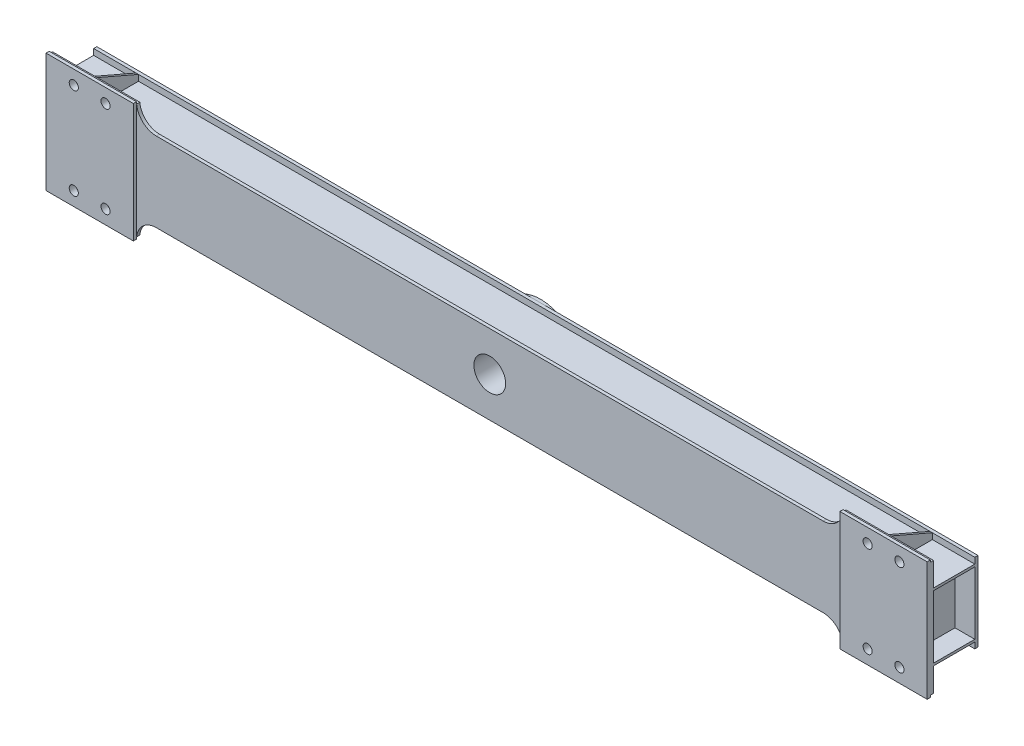
from build123d import *

# Parameters (mm, degrees)
SKETCH_1_W                       = 2220
SKETCH_1_H                       = 300
EXTRUDE_1_DEPTH                  = 120
SKETCH_2_W                       = 1780
SKETCH_2_H                       = 50
CUT_EXTRUDE_1_DEPTH              = 2244.390291501
SKETCH_3_W                       = 220
SKETCH_3_H                       = 300
EXTRUDE_2_DEPTH                  = 8
SKETCH_4_W                       = 2220
SKETCH_4_H                       = 120
CUT_EXTRUDE_2_DEPTH              = 5
SKETCH_5_W                       = 2220
SKETCH_5_H                       = 120
CUT_EXTRUDE_3_DEPTH              = 5
CUT_EXTRUDE_11_DEPTH             = 2244.832435812
SKETCH_14_W                      = 6
SKETCH_14_H                      = 104
EXTRUDE_3_DEPTH                  = 60
SKETCH_16_W                      = 6
SKETCH_16_H                      = 104
EXTRUDE_4_DEPTH                  = 60
CUT_EXTRUDE_12_DEPTH             = 2139.025490961
PATTERN_LINEAR_2_COUNT           = 2
PATTERN_LINEAR_2_PITCH           = 2000
FILLET_3_R                       = 50
SKETCH_17_W                      = 104
SKETCH_17_H                      = 158
CUT_EXTRUDE_13_DEPTH             = 50
SKETCH_18_W                      = 104
SKETCH_18_H                      = 158
CUT_EXTRUDE_14_DEPTH             = 50
SKETCH_19_R                      = 100
EXTRUDE_5_DEPTH                  = 8
SKETCH_20_R                      = 40
CUT_EXTRUDE_15_DEPTH             = 2245.303009845
SKETCH_21_R                      = 11.5
CUT_EXTRUDE_16_DEPTH             = 2245.303009845
PATTERN_LINEAR_3_COUNT           = 2
PATTERN_LINEAR_3_PITCH           = 80
PATTERN_LINEAR_3_COUNT_DIR2      = 2
PATTERN_LINEAR_3_PITCH_DIR2      = 230
PATTERN_LINEAR_4_COUNT           = 2
PATTERN_LINEAR_4_PITCH           = 2000
PATTERN_LINEAR_4_COPY_1_SKETCH_R = 11.5
PATTERN_LINEAR_4_COPY_1_DEPTH    = 2245.303009845
PATTERN_LINEAR_4_COPY_2_SKETCH_R = 11.5
PATTERN_LINEAR_4_COPY_2_DEPTH    = 2245.303009845
PATTERN_LINEAR_4_COPY_3_SKETCH_R = 11.5
PATTERN_LINEAR_4_COPY_3_DEPTH    = 2245.303009845
SKETCH_22_R                      = 5
CUT_EXTRUDE_17_DEPTH             = 100
PATTERN_LINEAR_5_COUNT           = 2
PATTERN_LINEAR_5_PITCH           = 80
PATTERN_LINEAR_5_COUNT_DIR2      = 2
PATTERN_LINEAR_5_PITCH_DIR2      = 80
PATTERN_LINEAR_6_COUNT           = 2
PATTERN_LINEAR_6_PITCH           = 2000
PATTERN_LINEAR_6_COPY_1_SKETCH_R = 5
PATTERN_LINEAR_6_COPY_1_DEPTH    = 100
PATTERN_LINEAR_6_COPY_2_SKETCH_R = 5
PATTERN_LINEAR_6_COPY_2_DEPTH    = 100
PATTERN_LINEAR_6_COPY_3_SKETCH_R = 5
PATTERN_LINEAR_6_COPY_3_DEPTH    = 100


with BuildPart() as part:
    # 草图1 → 凸台-拉伸1 (new body)
    with BuildSketch(Plane.XY):
        with Locations((1110, 150)):
            Rectangle(SKETCH_1_W, SKETCH_1_H)
    extrude(amount=EXTRUDE_1_DEPTH)

    # 草图2 → 切除-拉伸1 (cut, through all)
    with BuildSketch(Plane.XY.offset(120)):
        with Locations((1110, 275)):
            Rectangle(SKETCH_2_W, SKETCH_2_H)
        with Locations((1110, 25)):
            Rectangle(SKETCH_2_W, SKETCH_2_H)
    extrude(amount=-CUT_EXTRUDE_1_DEPTH, mode=Mode.SUBTRACT)

    # 草图3 → 凸台-拉伸2 (add)
    with BuildSketch(Plane.XY.offset(120)):
        with Locations((110, 150)):
            Rectangle(SKETCH_3_W, SKETCH_3_H)
        with Locations((2110, 150)):
            Rectangle(SKETCH_3_W, SKETCH_3_H)
    extrude(amount=EXTRUDE_2_DEPTH)

    # 草图4 → 切除-拉伸2 (cut)
    with BuildSketch(Plane(origin=(0, 300, 0), x_dir=(1, 0, 0), z_dir=(0, 1, 0))):
        with Locations((1110, -60)):
            Rectangle(SKETCH_4_W, SKETCH_4_H)
    extrude(amount=-CUT_EXTRUDE_2_DEPTH, mode=Mode.SUBTRACT)

    # 草图5 → 切除-拉伸3 (cut)
    with BuildSketch(Plane.XZ):
        with Locations((1110, 60)):
            Rectangle(SKETCH_5_W, SKETCH_5_H)
    extrude(amount=-CUT_EXTRUDE_3_DEPTH, mode=Mode.SUBTRACT)

    # 草图13 → 切除-拉伸11 (cut, through all)
    with BuildSketch(Plane(origin=(2220, 0, 0), x_dir=(0, 0, -1), z_dir=(1, 0, 0))):
        Polygon((-112, 235), (-8, 235), (-8, 250), (0, 250), (0, 295), (-112, 295), align=None)
        Polygon((-112, 5), (0, 5), (0, 50), (-8, 50), (-8, 65), (-112, 65), align=None)
    extrude(amount=-CUT_EXTRUDE_11_DEPTH, mode=Mode.SUBTRACT)

    # 草图14 → 凸台-拉伸3 (add)
    with BuildSketch(Plane(origin=(0, 235, 0), x_dir=(1, 0, 0), z_dir=(0, 1, 0))):
        with Locations((2110, -60)):
            Rectangle(SKETCH_14_W, SKETCH_14_H)
    extrude_3 = extrude(amount=EXTRUDE_3_DEPTH)

    # 草图16 → 凸台-拉伸4 (add)
    with BuildSketch(Plane.XZ.offset(-65)):
        with Locations((2110, 60)):
            Rectangle(SKETCH_16_W, SKETCH_16_H)
    extrude_4 = extrude(amount=EXTRUDE_4_DEPTH)

    # 草图15 → 切除-拉伸12 (cut, through all)
    with BuildSketch(Plane(origin=(2113, 0, 0), x_dir=(0, 0, -1), z_dir=(1, 0, 0))):
        Polygon((-8, 295), (-8, 250), (-112, 295), align=None)
        Polygon((-8, 50), (-112, 5), (-8, 5), align=None)
    cut_extrude_12 = extrude(amount=-CUT_EXTRUDE_12_DEPTH, mode=Mode.SUBTRACT)

    # 阵列(线性)2: 凸台-拉伸3, 凸台-拉伸4, 切除-拉伸12 ×2
    with Locations(*[(-i * PATTERN_LINEAR_2_PITCH, 0, 0) for i in range(1, PATTERN_LINEAR_2_COUNT)]):
        add(extrude_3)
        add(extrude_4)
        add(cut_extrude_12, mode=Mode.SUBTRACT)

    # 圆角3
    # the kernel refuses this fillet: 50 mm, written as the material it adds along each edge
    with BuildSketch(Plane(origin=(220, 250, 120), x_dir=(0, 1, 0), z_dir=(0, 0, -1))) as fillet_3_piece_1_section:
        with BuildLine():
            CenterArc((FILLET_3_R, FILLET_3_R), FILLET_3_R, 180, 90)
            Line((0, FILLET_3_R), (0, 0))
            Line((0, 0), (FILLET_3_R, 0))
        make_face()
    fillet_3_piece_1 = extrude(amount=8, mode=Mode.PRIVATE)
    fillet_3_piece_1 = split(fillet_3_piece_1, bisect_by=Plane(origin=(231.177032, 295, 116), z_dir=(0, -1, 0)), keep=Keep.TOP, mode=Mode.PRIVATE)
    add(fillet_3_piece_1)
    with BuildSketch(Plane(origin=(2000, 250, 120), x_dir=(-1, 0, 0), z_dir=(0, 0, -1))) as fillet_3_piece_2_section:
        with BuildLine():
            CenterArc((FILLET_3_R, FILLET_3_R), FILLET_3_R, 180, 90)
            Line((0, FILLET_3_R), (0, 0))
            Line((0, 0), (FILLET_3_R, 0))
        make_face()
    fillet_3_piece_2 = extrude(amount=8, mode=Mode.PRIVATE)
    fillet_3_piece_2 = split(fillet_3_piece_2, bisect_by=Plane(origin=(1988.822968, 295, 116), z_dir=(0, -1, 0)), keep=Keep.TOP, mode=Mode.PRIVATE)
    add(fillet_3_piece_2)
    with BuildSketch(Plane(origin=(2000, 50, 120), x_dir=(-1, 0, 0), z_dir=(0, 0, -1))) as fillet_3_piece_3_section:
        with BuildLine():
            CenterArc((FILLET_3_R, -FILLET_3_R), FILLET_3_R, 90, 90)
            Line((0, -FILLET_3_R), (0, 0))
            Line((0, 0), (FILLET_3_R, 0))
        make_face()
    fillet_3_piece_3 = extrude(amount=8, mode=Mode.PRIVATE)
    fillet_3_piece_3 = split(fillet_3_piece_3, bisect_by=Plane(origin=(1988.822968, 5, 116), z_dir=(0, 1, 0)), keep=Keep.TOP, mode=Mode.PRIVATE)
    add(fillet_3_piece_3)
    with BuildSketch(Plane(origin=(220, 50, 120), x_dir=(0, -1, 0), z_dir=(0, 0, -1))) as fillet_3_piece_4_section:
        with BuildLine():
            CenterArc((FILLET_3_R, -FILLET_3_R), FILLET_3_R, 90, 90)
            Line((0, -FILLET_3_R), (0, 0))
            Line((0, 0), (FILLET_3_R, 0))
        make_face()
    fillet_3_piece_4 = extrude(amount=8, mode=Mode.PRIVATE)
    fillet_3_piece_4 = split(fillet_3_piece_4, bisect_by=Plane(origin=(231.177032, 5, 116), z_dir=(0, 1, 0)), keep=Keep.TOP, mode=Mode.PRIVATE)
    add(fillet_3_piece_4)

    # 草图17 → 切除-拉伸13 (cut)
    with BuildSketch(Plane.ZY):
        with Locations((60, 150)):
            Rectangle(SKETCH_17_W, SKETCH_17_H)
    extrude(amount=-CUT_EXTRUDE_13_DEPTH, mode=Mode.SUBTRACT)

    # 草图18 → 切除-拉伸14 (cut)
    with BuildSketch(Plane(origin=(2220, 0, 0), x_dir=(0, 0, -1), z_dir=(1, 0, 0))):
        with Locations((-60, 150)):
            Rectangle(SKETCH_18_W, SKETCH_18_H)
    extrude(amount=-CUT_EXTRUDE_14_DEPTH, mode=Mode.SUBTRACT)

    # 草图19 → 凸台-拉伸5 (add)
    with BuildSketch(Plane(origin=(0, 0, 0), x_dir=(-1, 0, 0), z_dir=(0, 0, -1))):
        with Locations(Location((-1110, 150, 0), (0, 0, 270))):
            Circle(SKETCH_19_R)
    extrude(amount=EXTRUDE_5_DEPTH)

    # 草图20 → 切除-拉伸15 (cut, through all)
    with BuildSketch(Plane(origin=(0, 0, -8), x_dir=(-1, 0, 0), z_dir=(0, 0, -1))):
        with Locations((-1110, 150)):
            Circle(SKETCH_20_R)
    extrude(amount=-CUT_EXTRUDE_15_DEPTH, mode=Mode.SUBTRACT)

    # 草图21 → 切除-拉伸16 (cut, through all)
    with BuildSketch(Plane.XY.offset(128)):
        with Locations((2150, 35)):
            Circle(SKETCH_21_R)
    cut_extrude_16 = extrude(amount=-CUT_EXTRUDE_16_DEPTH, mode=Mode.SUBTRACT)

    # 阵列(线性)3: Cut-Extrude 16 2 × 2
    with Locations(*[(-i * PATTERN_LINEAR_3_PITCH, j * PATTERN_LINEAR_3_PITCH_DIR2, 0) for i in range(PATTERN_LINEAR_3_COUNT) for j in range(PATTERN_LINEAR_3_COUNT_DIR2) if (i, j) != (0, 0)]):
        add(cut_extrude_16, mode=Mode.SUBTRACT)

    # 阵列(线性)4: 切除-拉伸16 ×2
    with Locations(*[(-i * PATTERN_LINEAR_4_PITCH, 0, 0) for i in range(1, PATTERN_LINEAR_4_COUNT)]):
        add(cut_extrude_16, mode=Mode.SUBTRACT)

    # 阵列(线性)4 copy 1 sketch → 阵列(线性)4 copy 1 (cut, through all)
    with BuildSketch(Plane(origin=(-2000, 230, 128), x_dir=(1, 0, 0), z_dir=(0, 0, 1))):
        with Locations((2150, 35)):
            Circle(PATTERN_LINEAR_4_COPY_1_SKETCH_R)
    extrude(amount=-PATTERN_LINEAR_4_COPY_1_DEPTH, mode=Mode.SUBTRACT)

    # 阵列(线性)4 copy 2 sketch → 阵列(线性)4 copy 2 (cut, through all)
    with BuildSketch(Plane(origin=(-2080, 0, 128), x_dir=(1, 0, 0), z_dir=(0, 0, 1))):
        with Locations((2150, 35)):
            Circle(PATTERN_LINEAR_4_COPY_2_SKETCH_R)
    extrude(amount=-PATTERN_LINEAR_4_COPY_2_DEPTH, mode=Mode.SUBTRACT)

    # 阵列(线性)4 copy 3 sketch → 阵列(线性)4 copy 3 (cut, through all)
    with BuildSketch(Plane(origin=(-2080, 230, 128), x_dir=(1, 0, 0), z_dir=(0, 0, 1))):
        with Locations((2150, 35)):
            Circle(PATTERN_LINEAR_4_COPY_3_SKETCH_R)
    extrude(amount=-PATTERN_LINEAR_4_COPY_3_DEPTH, mode=Mode.SUBTRACT)

    # 草图22 → 切除-拉伸17 (cut)
    with BuildSketch(Plane(origin=(0, 0, 0), x_dir=(-1, 0, 0), z_dir=(0, 0, -1))):
        with Locations((-2150, 190)):
            Circle(SKETCH_22_R)
    cut_extrude_17 = extrude(amount=-CUT_EXTRUDE_17_DEPTH, mode=Mode.SUBTRACT)

    # 阵列(线性)5: Cut-Extrude 17 2 × 2
    with Locations(*[(-i * PATTERN_LINEAR_5_PITCH, -j * PATTERN_LINEAR_5_PITCH_DIR2, 0) for i in range(PATTERN_LINEAR_5_COUNT) for j in range(PATTERN_LINEAR_5_COUNT_DIR2) if (i, j) != (0, 0)]):
        add(cut_extrude_17, mode=Mode.SUBTRACT)

    # 阵列(线性)6: 切除-拉伸17 ×2
    with Locations(*[(-i * PATTERN_LINEAR_6_PITCH, 0, 0) for i in range(1, PATTERN_LINEAR_6_COUNT)]):
        add(cut_extrude_17, mode=Mode.SUBTRACT)

    # 阵列(线性)6 copy 1 sketch → 阵列(线性)6 copy 1 (cut)
    with BuildSketch(Plane(origin=(-2000, -80, 0), x_dir=(-1, 0, 0), z_dir=(0, 0, -1))):
        with Locations((-2150, 190)):
            Circle(PATTERN_LINEAR_6_COPY_1_SKETCH_R)
    extrude(amount=-PATTERN_LINEAR_6_COPY_1_DEPTH, mode=Mode.SUBTRACT)

    # 阵列(线性)6 copy 2 sketch → 阵列(线性)6 copy 2 (cut)
    with BuildSketch(Plane(origin=(-2080, 0, 0), x_dir=(-1, 0, 0), z_dir=(0, 0, -1))):
        with Locations((-2150, 190)):
            Circle(PATTERN_LINEAR_6_COPY_2_SKETCH_R)
    extrude(amount=-PATTERN_LINEAR_6_COPY_2_DEPTH, mode=Mode.SUBTRACT)

    # 阵列(线性)6 copy 3 sketch → 阵列(线性)6 copy 3 (cut)
    with BuildSketch(Plane(origin=(-2080, -80, 0), x_dir=(-1, 0, 0), z_dir=(0, 0, -1))):
        with Locations((-2150, 190)):
            Circle(PATTERN_LINEAR_6_COPY_3_SKETCH_R)
    extrude(amount=-PATTERN_LINEAR_6_COPY_3_DEPTH, mode=Mode.SUBTRACT)


solid = part.part
